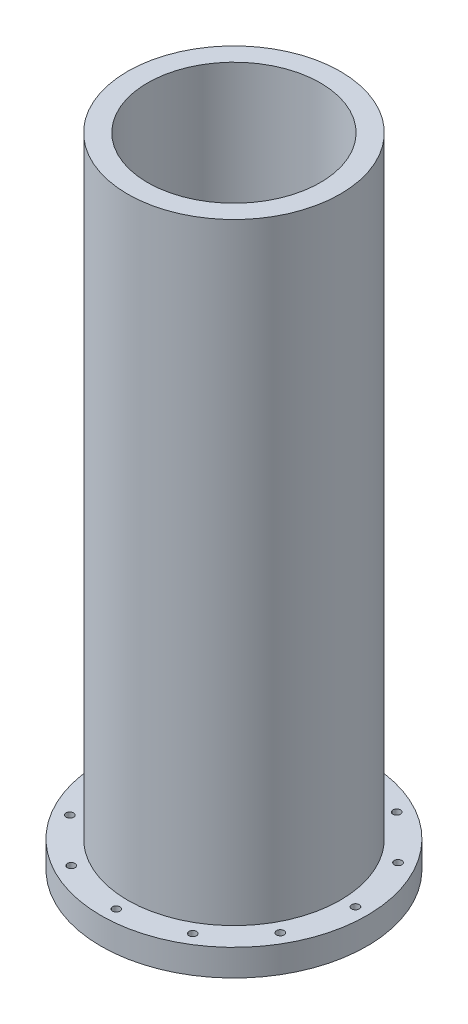
from build123d import *

# Parameters (mm, degrees)
SKETCH2_R               = 50.8
SKETCH2_R_2             = 41.275
BOSS_EXTRUDE1_DEPTH     = 304.8
SKETCH4_R               = 63.5
SKETCH4_R_2             = 44.45
BOSS_EXTRUDE3_DEPTH     = 12.7
CUT_EXTRUDE1_DEPTH      = 306.592719154
CUT_EXTRUDE1_DEPTH_BACK = 306.592719154
SKETCH5_R               = 1.814679062


with BuildPart() as part:
    # Sketch2 → Boss-Extrude1 (new body)
    with BuildSketch(Plane(origin=(0, 0, 0), x_dir=(1, 0, 0), z_dir=(0, 1, 0))):
        Circle(SKETCH2_R)
        Circle(SKETCH2_R_2, mode=Mode.SUBTRACT)
    extrude(amount=BOSS_EXTRUDE1_DEPTH)

    # Sketch4 → Boss-Extrude3 (add)
    with BuildSketch(Plane(origin=(0, 0, 0), x_dir=(1, 0, 0), z_dir=(0, 1, 0))):
        Circle(SKETCH4_R)
        Circle(SKETCH4_R_2, mode=Mode.SUBTRACT)
    extrude(amount=BOSS_EXTRUDE3_DEPTH)

    # Sketch5 → Cut-Extrude1 (cut, two sides: drawn at the far end of the back side and taken through both)
    with BuildSketch(Plane(origin=(0, 12.7, 0), x_dir=(1, 0, 0), z_dir=(0, 1, 0)).offset(-CUT_EXTRUDE1_DEPTH_BACK)):
        with Locations((29.354015513, -49.035336985)):
            Circle(SKETCH5_R)
        with Locations((0.903654645, -57.142855269)):
            Circle(SKETCH5_R)
        with Locations((-27.788839756, -49.93899163)):
            Circle(SKETCH5_R)
        with Locations((-49.035336985, -29.354015513)):
            Circle(SKETCH5_R)
        with Locations((-57.142855269, -0.903654645)):
            Circle(SKETCH5_R)
        with Locations((-49.93899163, 27.788839756)):
            Circle(SKETCH5_R)
        with Locations((-29.354015513, 49.035336985)):
            Circle(SKETCH5_R)
        with Locations((-0.903654645, 57.142855269)):
            Circle(SKETCH5_R)
        with Locations((27.788839756, 49.93899163)):
            Circle(SKETCH5_R)
        with Locations((49.035336985, 29.354015513)):
            Circle(SKETCH5_R)
        with Locations((57.142855269, 0.903654645)):
            Circle(SKETCH5_R)
        with Locations((49.93899163, -27.788839756)):
            Circle(SKETCH5_R)
    extrude(amount=CUT_EXTRUDE1_DEPTH + CUT_EXTRUDE1_DEPTH_BACK, mode=Mode.SUBTRACT)


solid = part.part
